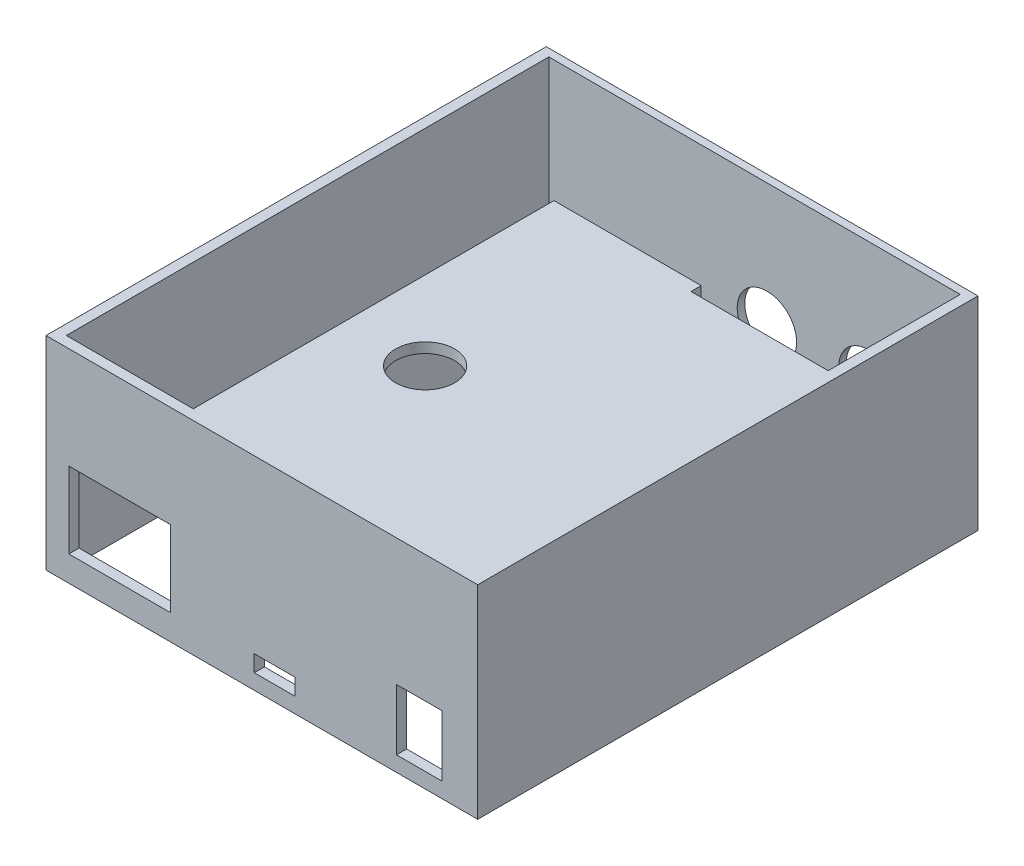
from build123d import *

# Parameters (mm, degrees)
SKETCH_1_W                   = 85
SKETCH_1_H                   = 98.49643328
EXTRUDE_1_DEPTH              = 2
SKETCH_1_6_W                 = 2
SKETCH_1_6_H                 = 95
EXTRUDE_2_DEPTH              = 40
SKETCH_1_7_W                 = 54
SKETCH_1_7_H                 = 2
BOSS_EXTRUDE1_DEPTH          = 15
F_10_0_START                 = -75.720313778
F_10_0_MM_DOWEL_HOLES1_DEPTH = 1.49643328
SKETCH5_W                    = 9
SKETCH5_H                    = 12
SKETCH5_W_2                  = 8
SKETCH5_H_2                  = 3.244606683
SKETCH5_W_3                  = 20
SKETCH5_H_3                  = 15
CUT_EXTRUDE1_DEPTH           = 15
SKETCH8_W                    = 25
SKETCH8_H                    = 95
SKETCH8_W_2                  = 54
SKETCH8_H_2                  = 69
CUT_EXTRUDE2_DEPTH           = 10
BOSS_EXTRUDE2_DEPTH          = 25
SKETCH11_R                   = 5.8
BOSS_EXTRUDE3_DEPTH          = 2
CAVITY1_START                = -49.696743418
CAVITY1_OUTLINE_W            = 0.5
CAVITY1_OUTLINE_H            = 3
CAVITY1_DEPTH                = 26
CAVITY1_START_2              = -38.196743418
CAVITY1_2_OUTLINE_W          = 0.5
CAVITY1_2_OUTLINE_H          = 0.5
CAVITY1_2_DEPTH              = 3
CAVITY2_START                = 0.5
CAVITY2_OUTLINE_W            = 0.5
CAVITY2_OUTLINE_H            = 3
CAVITY2_DEPTH                = 0.5


# Read off the part's stored shape, not the designer's step: Ø10.0 mm Dowel Holes1, Cavity1, Cavity2
with BuildPart() as part:
    # ｽｹｯﾁ1 → ﾎﾞｽ - 押し出し1 (new body)
    with BuildSketch(Plane(origin=(0, 0, 0), x_dir=(1, 0, 0), z_dir=(0, 1, 0))):
        with Locations((-8.696743418, 26.472097138)):
            Rectangle(SKETCH_1_W, SKETCH_1_H)
    extrude(amount=EXTRUDE_1_DEPTH)

    # ｽｹｯﾁ1<6> → ﾎﾞｽ - 押し出し2 (add)
    with BuildSketch(Plane(origin=(0, 0, 0), x_dir=(1, 0, 0), z_dir=(0, 1, 0))):
        with Locations((-50.196743418, 26.723880498)):
            Rectangle(SKETCH_1_6_W, SKETCH_1_6_H)
        Polygon((33.803256582, -20.776119502), (31.803256582, -20.776119502), (-22.196743418, -20.776119502), (-24.196743418, -20.776119502), (-49.196743418, -20.776119502), (-51.196743418, -20.776119502), (-51.196743418, -22.776119502), (33.803256582, -22.776119502), align=None)
        Polygon((-22.196743418, 74.223880498), (31.803256582, 74.223880498), (31.803256582, 75.720313778), (-51.196743418, 75.720313778), (-51.196743418, 74.223880498), (-49.196743418, 74.223880498), (-24.196743418, 74.223880498), align=None)
        Polygon((31.803256582, 50.223880498), (31.803256582, 48.223880498), (31.803256582, -20.776119502), (33.803256582, -20.776119502), (33.803256582, 75.720313778), (31.803256582, 75.720313778), (31.803256582, 74.223880498), align=None)
    extrude(amount=EXTRUDE_2_DEPTH)

    # ｽｹｯﾁ1<7> → Boss-Extrude1 (add)
    with BuildSketch(Plane(origin=(0, 0, 0), x_dir=(1, 0, 0), z_dir=(0, 1, 0))):
        with Locations((4.803256582, 49.223880498)):
            Rectangle(SKETCH_1_7_W, SKETCH_1_7_H)
        Polygon((-22.196743418, -20.776119502), (-22.196743418, 48.223880498), (-22.196743418, 50.223880498), (-22.196743418, 74.223880498), (-24.196743418, 74.223880498), (-24.196743418, -20.776119502), align=None)
    extrude(amount=BOSS_EXTRUDE1_DEPTH)

    # Ø10.0 mm Dowel Holes1 outline → Ø10.0 mm Dowel Holes1 (cut)
    with BuildSketch(Plane.XY.offset(F_10_0_START)):
        with BuildLine():
            Line((-6.31353142, 9.931926182), (-6.21353142, 9.931926182))
            ThreePointArc((-6.21353142, 9.931926182), (-0.41353142, 15.731926182), (-6.21353142, 21.531926182))
            Line((-6.21353142, 21.531926182), (-6.31353142, 21.531926182))
            ThreePointArc((-6.31353142, 21.531926182), (-12.11353142, 15.731926182), (-6.31353142, 9.931926182))
        make_face()
        with BuildLine():
            ThreePointArc((13.78646858, 9.931926182), (19.58646858, 15.731926182), (13.78646858, 21.531926182))
            Line((13.78646858, 21.531926182), (13.68646858, 21.531926182))
            ThreePointArc((13.68646858, 21.531926182), (7.88646858, 15.731926182), (13.68646858, 9.931926182))
            Line((13.68646858, 9.931926182), (13.78646858, 9.931926182))
        make_face()
    extrude(amount=F_10_0_MM_DOWEL_HOLES1_DEPTH, mode=Mode.SUBTRACT)

    # Sketch5 → Cut-Extrude1 (cut)
    with BuildSketch(Plane(origin=(0, 0, 20.776119502), x_dir=(-1, 0, 0), z_dir=(0, 0, -1))):
        with Locations((-22.303256582, 9)):
            Rectangle(SKETCH5_W, SKETCH5_H)
        with Locations((6.196743418, 4.622303342)):
            Rectangle(SKETCH5_W_2, SKETCH5_H_2)
        with Locations((36.696743418, 12.5)):
            Rectangle(SKETCH5_W_3, SKETCH5_H_3)
    extrude(amount=-CUT_EXTRUDE1_DEPTH, mode=Mode.SUBTRACT)

    # Sketch8 → Cut-Extrude2 (cut)
    with BuildSketch(Plane(origin=(0, 2, 0), x_dir=(1, 0, 0), z_dir=(0, 1, 0))):
        with Locations((-36.696743418, 26.723880498)):
            Rectangle(SKETCH8_W, SKETCH8_H)
        with Locations((4.803256582, 13.723880498)):
            Rectangle(SKETCH8_W_2, SKETCH8_H_2)
    extrude(amount=-CUT_EXTRUDE2_DEPTH, mode=Mode.SUBTRACT)



with BuildPart() as body_2:
    # Sketch9 → Boss-Extrude2 (new body)
    with BuildSketch(Plane(origin=(0, 15, 0), x_dir=(1, 0, 0), z_dir=(0, 1, 0))):
        Polygon((-22.196743418, -20.776119502), (-22.196743418, 48.223880498), (4.803256582, 48.223880498), (4.803256582, 50.223880498), (-24.196743418, 50.223880498), (-24.196743418, -20.776119502), align=None)
    extrude(amount=BOSS_EXTRUDE2_DEPTH)


with BuildPart() as part_1:
    add(part.part)

    add(body_2.part)  # Boss-Extrude3 merges body 2
    # Sketch11 → Boss-Extrude3 (add)
    with BuildSketch(Plane(origin=(0, 40, 0), x_dir=(1, 0, 0), z_dir=(0, 1, 0))):
        Polygon((31.803256582, 48.223880498), (-22.196743418, 48.223880498), (-22.196743418, 9.365118158), (-22.196743418, -20.776119502), (31.803256582, -20.776119502), align=None)
        with Locations(Location((-8.696743418, 9.365118158, 0), (0, 0, 270))):
            Circle(SKETCH11_R, mode=Mode.SUBTRACT)
    extrude(amount=-BOSS_EXTRUDE3_DEPTH)

    # Cavity1 outline → Cavity1 (cut)
    with BuildSketch(Plane.YZ.offset(CAVITY1_START)):
        with Locations((0.75, -7.451121589)):
            Rectangle(CAVITY1_OUTLINE_W, CAVITY1_OUTLINE_H)
        with Locations((0.75, -32.451121589)):
            Rectangle(CAVITY1_OUTLINE_W, CAVITY1_OUTLINE_H)
        with Locations((0.75, -57.451121589)):
            Rectangle(CAVITY1_OUTLINE_W, CAVITY1_OUTLINE_H)
    extrude(amount=CAVITY1_DEPTH, mode=Mode.SUBTRACT)

    # Cavity1 2 outline → Cavity1 2 (cut)
    with BuildSketch(Plane.YZ.offset(CAVITY1_START_2)):
        with Locations((0.75, 21.026119502)):
            Rectangle(CAVITY1_2_OUTLINE_W, CAVITY1_2_OUTLINE_H)
    extrude(amount=CAVITY1_2_DEPTH, mode=Mode.SUBTRACT)

    # Cavity2 outline → Cavity2 (cut)
    with BuildSketch(Plane(origin=(0, 0, 0), x_dir=(1, 0, 0), z_dir=(0, 1, 0)).offset(CAVITY2_START)):
        Polygon((-7.196747436, 48.227352565), (-7.197904792, 48.727351226), (-10.197896755, 48.720407091), (-10.196747436, 48.223880498), (-8.696743418, 48.223880498), align=None)
        Polygon((16.802103245, 48.720407091), (16.803252564, 48.223880498), (18.303256582, 48.223880498), (19.803252564, 48.227352565), (19.802095208, 48.727351226), align=None)
        with Locations((-22.446743418, 36.723880498)):
            Rectangle(CAVITY2_OUTLINE_W, CAVITY2_OUTLINE_H)
        with Locations((32.053256582, 36.723880498)):
            Rectangle(CAVITY2_OUTLINE_W, CAVITY2_OUTLINE_H)
        with Locations((-22.446743418, 13.723880498)):
            Rectangle(CAVITY2_OUTLINE_W, CAVITY2_OUTLINE_H)
        with Locations((32.053256582, 13.723880498)):
            Rectangle(CAVITY2_OUTLINE_W, CAVITY2_OUTLINE_H)
        with Locations((-22.446743418, -9.276119502)):
            Rectangle(CAVITY2_OUTLINE_W, CAVITY2_OUTLINE_H)
        with Locations((32.053256582, -9.276119502)):
            Rectangle(CAVITY2_OUTLINE_W, CAVITY2_OUTLINE_H)
        Polygon((-8.696743418, -20.776119502), (-10.196747436, -20.776119502), (-10.197896755, -21.272646095), (-7.197904792, -21.27959023), (-7.196747436, -20.779591569), align=None)
        Polygon((19.803252564, -20.779591569), (18.303256578, -20.776119502), (16.803252564, -20.776119502), (16.802103245, -21.272646095), (19.802095208, -21.27959023), align=None)
    extrude(amount=CAVITY2_DEPTH, mode=Mode.SUBTRACT)


solid = part_1.part
